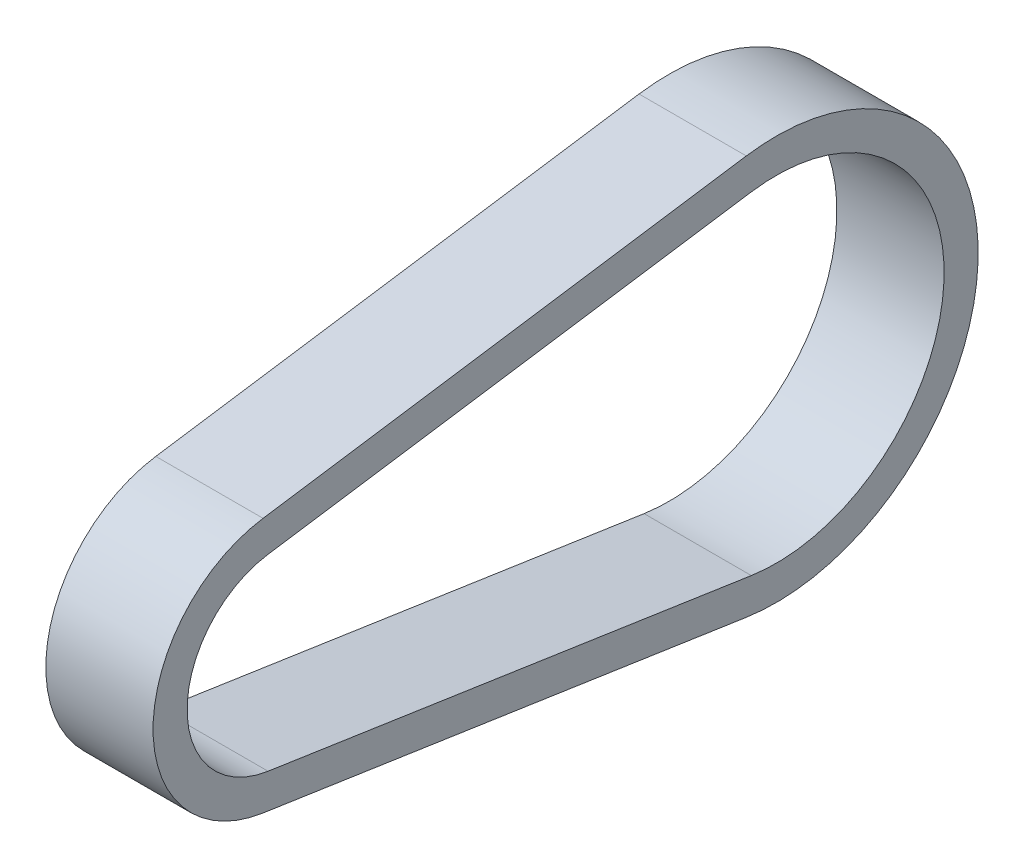
from build123d import *

# Parameters (mm, degrees)
BOSS_EXTRUDE1_DEPTH = 7.5


with BuildPart() as part:
    # Sketch1 → Boss-Extrude1 (new, symmetric)
    with BuildSketch(Plane(origin=(0, 0, 0), x_dir=(0, 0, -1), z_dir=(1, 0, 0))):
        with BuildLine():
            Line((-2.66604254, 17.848686172), (64.926589203, 27.944938069))
            ThreePointArc((64.926589203, 27.944938069), (97.35566, 0), (64.926589203, -27.944938069))
            Line((64.926589203, -27.944938069), (-2.66604254, -17.848686172))
            ThreePointArc((-2.66604254, -17.848686172), (-18.0467, 0), (-2.66604254, 17.848686172))
        make_face()
        with BuildLine():
            Line((-1.962477478, 13.138441756), (65.630154264, 23.234693653))
            ThreePointArc((65.630154264, 23.234693653), (92.59316, 0), (65.630154264, -23.234693653))
            Line((65.630154264, -23.234693653), (-1.962477478, -13.138441756))
            ThreePointArc((-1.962477478, -13.138441756), (-13.2842, 0), (-1.962477478, 13.138441756))
        make_face(mode=Mode.SUBTRACT)
    extrude(amount=BOSS_EXTRUDE1_DEPTH, both=True)


solid = part.part
